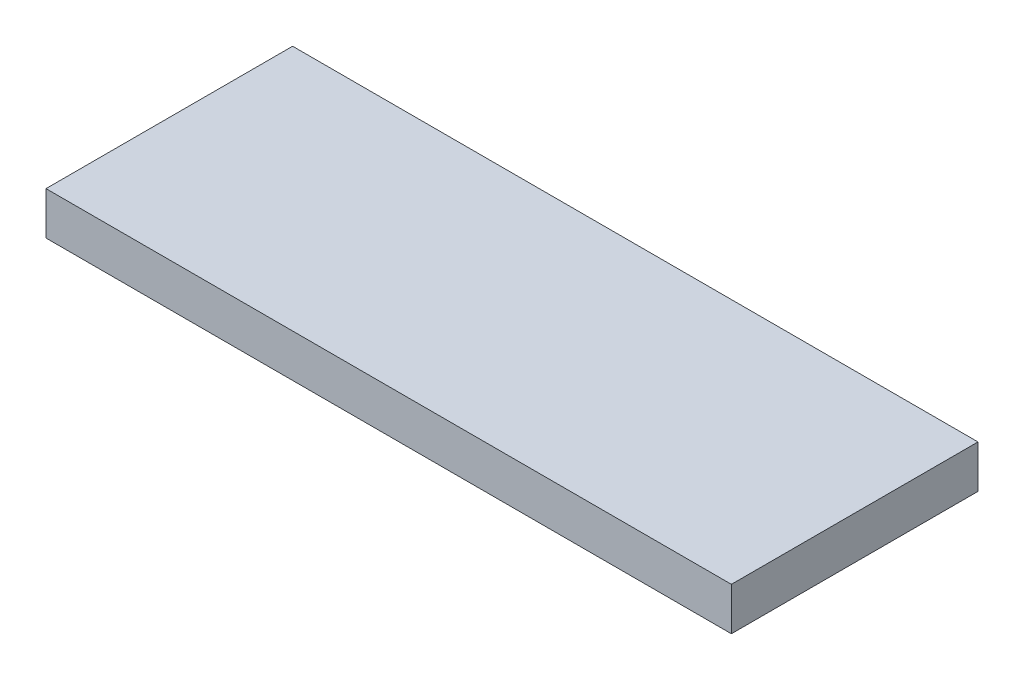
from build123d import *

# Parameters (mm, degrees)
SKETCH1_W           = 20.32
SKETCH1_H           = 7.311539518
BOSS_EXTRUDE1_DEPTH = 1.27


with BuildPart() as part:
    # Sketch1 → Boss-Extrude1 (new body)
    with BuildSketch(Plane(origin=(0, 0, 0), x_dir=(1, 0, 0), z_dir=(0, 1, 0))):
        with Locations((-25.227851264, 0)):
            Rectangle(SKETCH1_W, SKETCH1_H)
    extrude(amount=BOSS_EXTRUDE1_DEPTH)


solid = part.part
